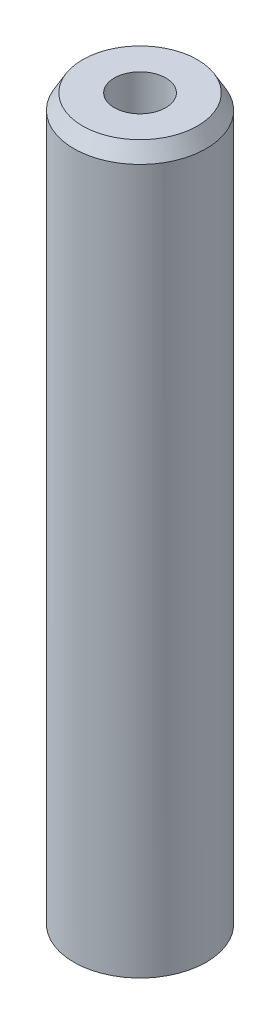
from build123d import *
from OCP.BRepFilletAPI import BRepFilletAPI_MakeChamfer

# Parameters (mm, degrees)
SKETCH1_R           = 10
BOSS_EXTRUDE1_DEPTH = 109.997766888
SKETCH2_R           = 3.888813568
CUT_EXTRUDE1_DEPTH  = 111.903150182
CHAMFER1_SIZE       = 2.297541549
CHAMFER1_SIZE2      = 1.326486232


with BuildPart() as part:
    # Sketch1 → Boss-Extrude1 (new body)
    with BuildSketch(Plane(origin=(0, 0, 0), x_dir=(1, 0, 0), z_dir=(0, 1, 0))):
        Circle(SKETCH1_R)
    extrude(amount=BOSS_EXTRUDE1_DEPTH)

    # Sketch2 → Cut-Extrude1 (cut, through all)
    with BuildSketch(Plane(origin=(0, 0, 0), x_dir=(1, 0, 0), z_dir=(0, 1, 0))):
        Circle(SKETCH2_R)
    extrude(amount=CUT_EXTRUDE1_DEPTH, mode=Mode.SUBTRACT)

    # Chamfer1: one chamfer whose edges measure the first distance from different faces: ONE call of the kernel's chamfer builder (chamfer() names one face for all edges)
    chamfer1_edges_1 = [part.edges().sort_by_distance(p)[0] for p in [
        (-10, 109.997766888, 0),
    ]]
    chamfer1_side_1 = [part.faces().sort_by_distance(p)[0] for p in [
        (-10, 54.998883444, 0),
    ]]
    chamfer1_edges_2 = [part.edges().sort_by_distance(p)[0] for p in [
        (-10, 0, 0),
    ]]
    chamfer1_side_2 = [part.faces().sort_by_distance(p)[0] for p in [
        (-9.717157288, 0, 0),
    ]]
    chamfer1 = BRepFilletAPI_MakeChamfer(part.part.solid().wrapped)
    for e in chamfer1_edges_1:
        chamfer1.Add(CHAMFER1_SIZE, CHAMFER1_SIZE2, e.wrapped, chamfer1_side_1[0].wrapped)  # the first distance lies on this face
    for e in chamfer1_edges_2:
        chamfer1.Add(CHAMFER1_SIZE, CHAMFER1_SIZE2, e.wrapped, chamfer1_side_2[0].wrapped)  # the first distance lies on this face
    add(Compound.cast(chamfer1.Shape()), mode=Mode.REPLACE)


solid = part.part
